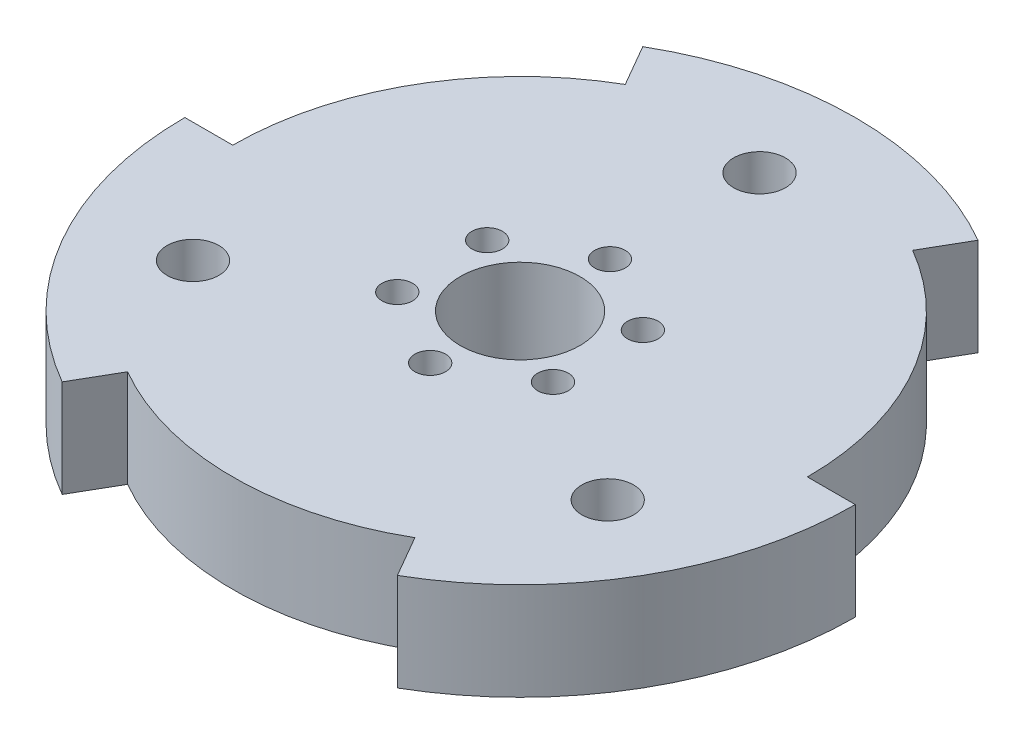
from build123d import *

# Parameters (mm, degrees)
SKETCH1_R               = 2.707265749
SKETCH1_R_2             = 6.25
BOSS_EXTRUDE1_DEPTH     = 10.18
CUT_EXTRUDE1_DEPTH      = 51.533478012
CUT_EXTRUDE1_DEPTH_BACK = 51.533478012
SKETCH6_R               = 1.6


with BuildPart() as part:
    # Sketch1 → Boss-Extrude1 (new body)
    with BuildSketch(Plane(origin=(0, 0, 0), x_dir=(1, 0, 0), z_dir=(0, 1, 0))):
        with BuildLine():
            ThreePointArc((30, 0), (25.980762114, 15), (15, 25.980762114))
            Line((15, 25.980762114), (17.5, 30.310889132))
            ThreePointArc((17.5, 30.310889132), (0, 35), (-17.5, 30.310889132))
            Line((-17.5, 30.310889132), (-15, 25.980762114))
            ThreePointArc((-15, 25.980762114), (-25.980762114, 15), (-30, 0))
            Line((-30, 0), (-35, 0))
            ThreePointArc((-35, 0), (-30.310889132, -17.5), (-17.5, -30.310889132))
            Line((-17.5, -30.310889132), (-15, -25.980762114))
            ThreePointArc((-15, -25.980762114), (0, -30), (15, -25.980762114))
            Line((15, -25.980762114), (17.5, -30.310889132))
            ThreePointArc((17.5, -30.310889132), (30.310889132, -17.5), (35, 0))
            Line((35, 0), (30, 0))
        make_face()
        with Locations((-21.650635095, -12.5)):
            Circle(SKETCH1_R, mode=Mode.SUBTRACT)
        with Locations((21.650635095, -12.5)):
            Circle(SKETCH1_R, mode=Mode.SUBTRACT)
        Circle(SKETCH1_R_2, mode=Mode.SUBTRACT)
        with Locations((0, 25)):
            Circle(SKETCH1_R, mode=Mode.SUBTRACT)
    extrude(amount=BOSS_EXTRUDE1_DEPTH)

    # Sketch6 → Cut-Extrude1 (cut, two sides: drawn at the far end of the back side and taken through both)
    with BuildSketch(Plane(origin=(0, 10.18, 0), x_dir=(1, 0, 0), z_dir=(0, 1, 0)).offset(-CUT_EXTRUDE1_DEPTH_BACK)):
        with Locations((0, -9.385)):
            Circle(SKETCH6_R)
        with Locations((-8.127648415, -4.6925)):
            Circle(SKETCH6_R)
        with Locations((-8.127648415, 4.6925)):
            Circle(SKETCH6_R)
        with Locations((0, 9.385)):
            Circle(SKETCH6_R)
        with Locations((8.127648415, 4.6925)):
            Circle(SKETCH6_R)
        with Locations((8.127648415, -4.6925)):
            Circle(SKETCH6_R)
    extrude(amount=CUT_EXTRUDE1_DEPTH + CUT_EXTRUDE1_DEPTH_BACK, mode=Mode.SUBTRACT)


solid = part.part
